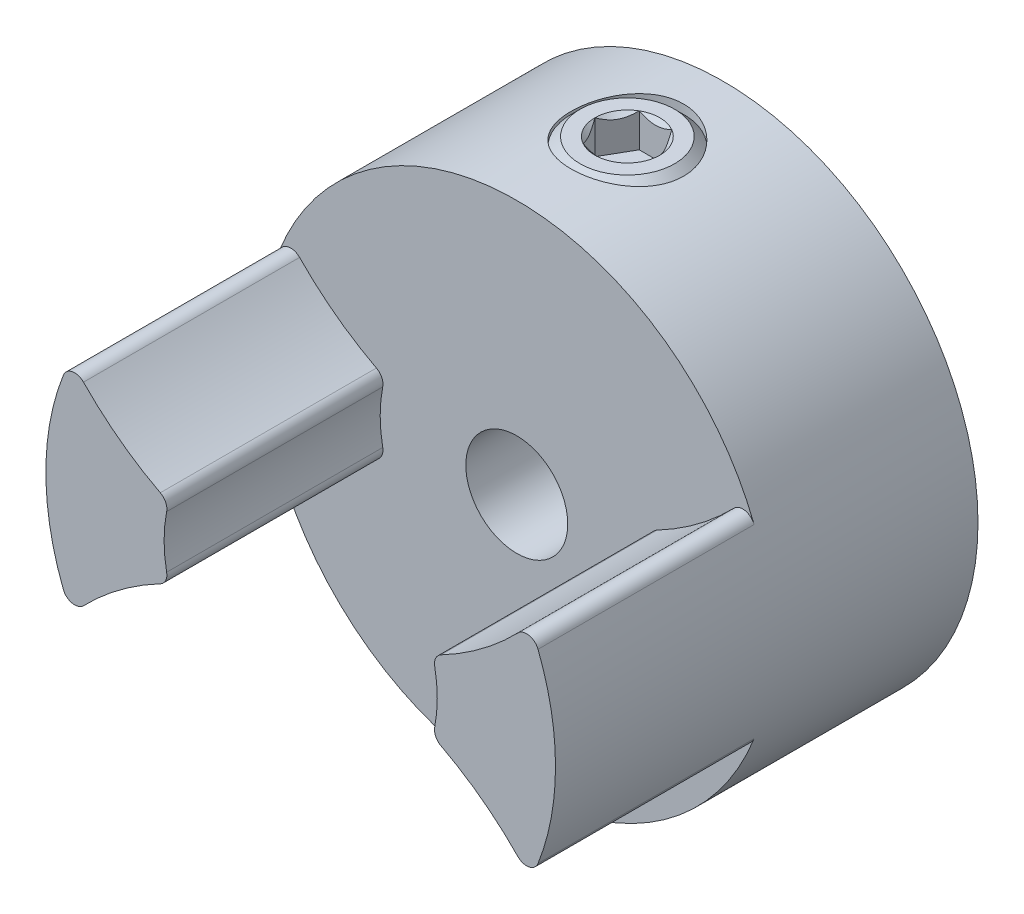
from build123d import *
from OCP.BRepFilletAPI import BRepFilletAPI_MakeChamfer
from build123d.topology import SkipClean

# Parameters (mm, degrees)
BOSS_EXTRUDE1_START     = -3.571875
SKETCH1_R               = 7.9375
BOSS_EXTRUDE1_DEPTH     = 6.746875
BOSS_EXTRUDE4_START     = 6.731
BOSS_EXTRUDE4_DEPTH     = 6.731
FILLET2_R               = 0.381
MOVE_START              = -3.571875
MOVE_FACE3_DEPTH        = 6.731
MOVE_FACE3_2_DEPTH      = 6.731
CIRPATTERN2_START       = -3.571875
CIRPATTERN2_DEPTH       = 6.731
CUT_EXTRUDE5_DEPTH      = 16.24743959
CUT_EXTRUDE5_DEPTH_BACK = 16.24743959
SKETCH15_R              = 1.5875
CHAMFER1_SIZE           = 0.3175
CHAMFER1_SIZE2          = 0.470713108
SKETCH5_R               = 1.7526
CUT_EXTRUDE2_DEPTH      = 16.24743959
SKETCH6_R               = 1.7526
BOSS_EXTRUDE3_DEPTH     = 4.7625
CUT_EXTRUDE3_DEPTH      = 1.05156
CHAMFER3_SIZE           = 0.280416
CHAMFER4_SIZE           = 0.595884


# Read off the part's stored shape, not the designer's step: Move Face3, CirPattern2
with BuildPart() as part:
    # Sketch1 → Boss-Extrude1 (new body)
    with BuildSketch(Plane.XY.offset(BOSS_EXTRUDE1_START)):
        Circle(SKETCH1_R)
    extrude(amount=-BOSS_EXTRUDE1_DEPTH)

    # Sketch10 → Boss-Extrude4 (add)
    with BuildSketch(Plane.XY.offset(-3.571875).offset(BOSS_EXTRUDE4_START)):
        with BuildLine():
            ThreePointArc((-1.096318236, -4.110821886), (0, -4.2545), (1.096318236, -4.110821886))
            ThreePointArc((1.096318236, -4.110821886), (2.111997853, -5.752575517), (3.440933621, -7.152893266))
            ThreePointArc((3.440933621, -7.152893266), (0, -7.9375), (-3.440933621, -7.152893266))
            ThreePointArc((-3.440933621, -7.152893266), (-2.111997853, -5.752575517), (-1.096318236, -4.110821886))
        make_face()
    extrude(amount=-BOSS_EXTRUDE4_DEPTH)

    # Fillet2
    fillet2_edges = [part.edges().sort_by_distance(p)[0] for p in [
        (-3.440933621, -7.152893266, -0.206375),
        (3.440933621, -7.152893266, -0.206375),
        (-1.096318236, -4.110821886, -0.206375),
        (1.096318236, -4.110821886, -0.206375),
    ]]
    fillet(fillet2_edges, radius=FILLET2_R)

    # Move Face3 outline → Move Face3 (cut)
    with BuildSketch(Plane.XY.offset(MOVE_START)):
        with BuildLine():
            ThreePointArc((-3.015425868, -6.764758592), (-3.123679186, -7.113503156), (-2.888846251, -7.393136925))
            ThreePointArc((-2.888846251, -7.393136925), (0, -7.9375), (2.888846251, -7.393136925))
            ThreePointArc((2.888846251, -7.393136925), (3.123679186, -7.113503156), (3.015425868, -6.764758592))
            ThreePointArc((3.015425868, -6.764758592), (2.026423119, -5.639802857), (1.228164561, -4.372350642))
            ThreePointArc((1.228164561, -4.372350642), (1.055516359, -4.205643666), (0.817454229, -4.175229195))
            ThreePointArc((0.817454229, -4.175229195), (0, -4.2545), (-0.817454229, -4.175229195))
            ThreePointArc((-0.817454229, -4.175229195), (-1.055516359, -4.205643666), (-1.228164561, -4.372350642))
            ThreePointArc((-1.228164561, -4.372350642), (-2.026423119, -5.639802857), (-3.015425868, -6.764758592))
        make_face()
    extrude(amount=MOVE_FACE3_DEPTH, mode=Mode.SUBTRACT)

    # Move Face3 2 outline → Move Face3 2 (add)
    with SkipClean():  # the faces are left unmerged after this step: merging them gives an invalid solid
        with BuildSketch(Plane.XY.offset(MOVE_START)):
            with BuildLine():
                ThreePointArc((7.393136925, 2.888846251), (7.113503156, 3.123679186), (6.764758592, 3.015425868))
                ThreePointArc((6.764758592, 3.015425868), (5.639802857, 2.026423119), (4.372350642, 1.228164561))
                ThreePointArc((4.372350642, 1.228164561), (4.205643666, 1.055516359), (4.175229195, 0.817454229))
                ThreePointArc((4.175229195, 0.817454229), (4.2545, 0), (4.175229195, -0.817454229))
                ThreePointArc((4.175229195, -0.817454229), (4.205643666, -1.055516359), (4.372350642, -1.228164561))
                ThreePointArc((4.372350642, -1.228164561), (5.639802857, -2.026423119), (6.764758592, -3.015425868))
                ThreePointArc((6.764758592, -3.015425868), (7.113503156, -3.123679186), (7.393136925, -2.888846251))
                ThreePointArc((7.393136925, -2.888846251), (7.9375, 0), (7.393136925, 2.888846251))
            make_face()
        extrude(amount=MOVE_FACE3_2_DEPTH)

    # CirPattern2 outline → CirPattern2 (add)
    with SkipClean():  # the faces are left unmerged after this step: merging them gives an invalid solid
        with BuildSketch(Plane.XY.offset(CIRPATTERN2_START)):
            with BuildLine():
                ThreePointArc((-4.372350642, 1.228164561), (-5.639802857, 2.026423119), (-6.764758592, 3.015425868))
                ThreePointArc((-6.764758592, 3.015425868), (-7.113503156, 3.123679186), (-7.393136925, 2.888846251))
                ThreePointArc((-7.393136925, 2.888846251), (-7.9375, 0), (-7.393136925, -2.888846251))
                ThreePointArc((-7.393136925, -2.888846251), (-7.113503156, -3.123679186), (-6.764758592, -3.015425868))
                ThreePointArc((-6.764758592, -3.015425868), (-5.639802857, -2.026423119), (-4.372350642, -1.228164561))
                ThreePointArc((-4.372350642, -1.228164561), (-4.205643666, -1.055516359), (-4.175229195, -0.817454229))
                ThreePointArc((-4.175229195, -0.817454229), (-4.2545, 0), (-4.175229195, 0.817454229))
                ThreePointArc((-4.175229195, 0.817454229), (-4.205643666, 1.055516359), (-4.372350642, 1.228164561))
            make_face()
        extrude(amount=CIRPATTERN2_DEPTH)

    # Sketch15 → Cut-Extrude5 (cut, two sides: drawn at the far end of the back side and taken through both)
    with SkipClean():  # the faces are left unmerged after this step: merging them gives an invalid solid
        with BuildSketch(Plane.XY.offset(-CUT_EXTRUDE5_DEPTH_BACK)):
            Circle(SKETCH15_R)
        extrude(amount=CUT_EXTRUDE5_DEPTH + CUT_EXTRUDE5_DEPTH_BACK, mode=Mode.SUBTRACT)

    # Chamfer1: one chamfer whose edges measure the first distance from different faces: ONE call of the kernel's chamfer builder (chamfer() names one face for all edges)
    chamfer1_edges_1 = [part.edges().sort_by_distance(p)[0] for p in [
        (-7.9375, 0, -10.31875),
    ]]
    chamfer1_side_1 = [part.faces().sort_by_distance(p)[0] for p in [
        (-7.9375, 0, -6.9453125),
    ]]
    chamfer1_edges_2 = [part.edges().sort_by_distance(p)[0] for p in [
        (-1.5875, 0, -10.31875),
    ]]
    chamfer1_side_2 = [part.faces().sort_by_distance(p)[0] for p in [
        (-1.5875, 0, -6.9453125),
    ]]
    chamfer1 = BRepFilletAPI_MakeChamfer(part.part.solid().wrapped)
    for e in chamfer1_edges_1:
        chamfer1.Add(CHAMFER1_SIZE, CHAMFER1_SIZE2, e.wrapped, chamfer1_side_1[0].wrapped)  # the first distance lies on this face
    for e in chamfer1_edges_2:
        chamfer1.Add(CHAMFER1_SIZE, CHAMFER1_SIZE2, e.wrapped, chamfer1_side_2[0].wrapped)  # the first distance lies on this face
    add(Compound.cast(chamfer1.Shape()), mode=Mode.REPLACE)

    # Sketch5 → Cut-Extrude2 (cut, through all)
    with SkipClean():  # the faces are left unmerged after this step: merging them gives an invalid solid
        with BuildSketch(Plane(origin=(0, 0, 0), x_dir=(1, 0, 0), z_dir=(0, 1, 0))):
            with Locations(Location((0, 7.01675, 0), (0, 0, 90))):
                Circle(SKETCH5_R)
        extrude(amount=CUT_EXTRUDE2_DEPTH, mode=Mode.SUBTRACT)


with BuildPart() as body_2:
    # Sketch6 → Boss-Extrude3 (new body)
    with BuildSketch(Plane(origin=(0, 7.9375, 0), x_dir=(-1, 0, 0), z_dir=(0, 1, 0))):
        with Locations(Location((0, -7.01675, 0), (0, 0, 90))):
            Circle(SKETCH6_R)
    extrude(amount=-BOSS_EXTRUDE3_DEPTH)

    # Sketch8 → Cut-Extrude3 (cut)
    with BuildSketch(Plane(origin=(0, 7.9375, 0), x_dir=(1, 0, 0), z_dir=(0, 1, 0))):
        Polygon((0.505932041, 6.14045), (1.011864082, 7.01675), (0.505932041, 7.89305), (-0.505932041, 7.89305), (-1.011864082, 7.01675), (-0.505932041, 6.14045), align=None)
    extrude(amount=-CUT_EXTRUDE3_DEPTH, mode=Mode.SUBTRACT)

    # Cut-Extrude4 cone 1 section (through the dimple's axis) → Cut-Extrude4 (revolve, cut)
    with BuildSketch(Plane(origin=(0, 7.9375, -7.01675), x_dir=(0, 0, 1), z_dir=(1, 0, 0))):
        Polygon((0, 0), (1.011864082, 0), (0, 1.011864082), align=None)
    revolve(axis=Axis((0, 7.9375, -7.01675), (0, -1, 0)), mode=Mode.SUBTRACT)

    # Chamfer3
    chamfer3_edges = [body_2.edges().sort_by_distance(p)[0] for p in [
        (0, 7.9375, -8.76935),
    ]]
    chamfer(chamfer3_edges, length=CHAMFER3_SIZE)

    # Chamfer4
    chamfer4_edges = [body_2.edges().sort_by_distance(p)[0] for p in [
        (0, 3.175, -8.76935),
    ]]
    chamfer(chamfer4_edges, length=CHAMFER4_SIZE)


solid = Compound([part.part, body_2.part])
